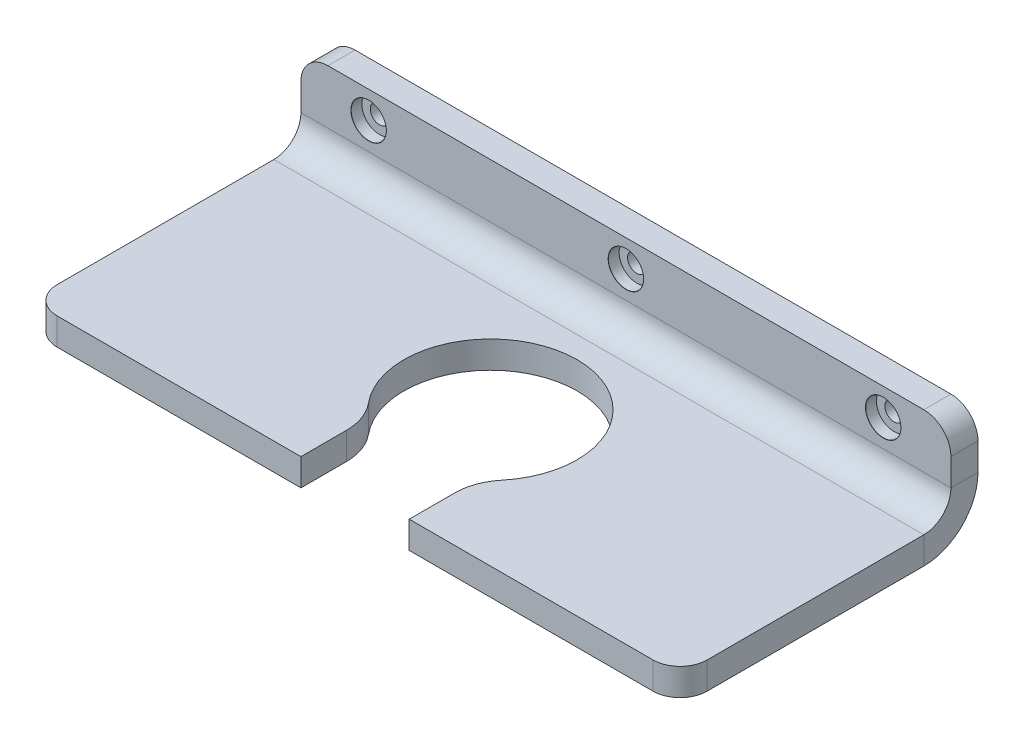
from build123d import *

# Parameters (mm, degrees)
SKETCH1_W                                  = 120
SKETCH1_H                                  = 50
BASE_FLANGE1_DEPTH                         = 5
EDGE_FLANGE1_STRIP_W                       = 30
EDGE_FLANGE1_STRIP_H                       = 5
EDGE_FLANGE1_STRIP_CUT_DEPTH               = 120
EDGE_FLANGE1_DEPTH                         = 120
CUT_EXTRUDE1_DEPTH                         = 10
CBORE_FOR_M3_CHEESE_HEAD_SCREW1_AT_2_COUNT = 2
CBORE_FOR_M3_CHEESE_HEAD_SCREW1_AT_2_PITCH = 47.5
CBORE_FOR_M3_CHEESE_HEAD_SCREW1_AT_3_COUNT = 2
CBORE_FOR_M3_CHEESE_HEAD_SCREW1_AT_3_PITCH = 95
BREAK_CORNER1_START                        = -30
BREAK_CORNER1_DEPTH                        = 5
BREAK_CORNER1_2_DEPTH                      = 5


# Read off the part's stored shape, not the designer's step: Break-Corner1
# Sheet-metal steps are written as plain solids
with BuildPart() as part:
    # Sketch1 → Base-Flange1 (new body)
    with BuildSketch(Plane(origin=(0, 0, 0), x_dir=(1, 0, 0), z_dir=(0, 1, 0))):
        Rectangle(SKETCH1_W, SKETCH1_H)
    extrude(amount=BASE_FLANGE1_DEPTH)

    # Edge-Flange1 strip (across the edge) → Edge-Flange1 strip cut (cut)
    with BuildSketch(Plane(origin=(60, 5, -25), x_dir=(0, 0, 1), z_dir=(-1, 0, 0))):
        with Locations((-10, -2.5)):
            Rectangle(EDGE_FLANGE1_STRIP_W, EDGE_FLANGE1_STRIP_H)
    extrude(amount=EDGE_FLANGE1_STRIP_CUT_DEPTH, mode=Mode.SUBTRACT)

    # Edge-Flange1 section (across the edge) → Edge-Flange1 (add)
    with BuildSketch(Plane(origin=(60, 5, -25), x_dir=(0, 0, 1), z_dir=(-1, 0, 0))):
        with BuildLine():
            Line((-5, 5), (-5, 15))
            Line((-5, 15), (0, 15))
            Line((0, 15), (0, 5))
            ThreePointArc((0, 5), (1.464466094, 1.464466094), (5, 0))
            Line((5, 0), (5, -5))
            ThreePointArc((5, -5), (-2.071067812, -2.071067812), (-5, 5))
        make_face()
    extrude(amount=EDGE_FLANGE1_DEPTH)

    # Sketch9 → Cut-Extrude1 (cut)
    with BuildSketch(Plane(origin=(0, 5, 0), x_dir=(1, 0, 0), z_dir=(0, 1, 0))):
        with BuildLine():
            Line((-10, -25), (-10, -16.613247726))
            ThreePointArc((-10, -16.613247726), (-10.594600569, -13.216416623), (-12.307692308, -10.223537062))
            ThreePointArc((-12.307692308, -10.223537062), (0, 16), (12.307692308, -10.223537062))
            ThreePointArc((12.307692308, -10.223537062), (10.594600569, -13.216416623), (10, -16.613247726))
            Line((10, -16.613247726), (10, -25))
            Line((10, -25), (-10, -25))
        make_face()
    extrude(amount=-CUT_EXTRUDE1_DEPTH, mode=Mode.SUBTRACT)

    # Sketch14 → CBORE for M3 Cheese Head Screw1 (revolve, cut)
    with BuildSketch(Plane(origin=(-47.5, 15, -25), x_dir=(0, -1, 0), z_dir=(1, 0, 0))):
        Polygon((0, 0), (0, 5), (1.7, 5), (1.7, 2), (3.25, 2), (3.25, 0.025), (3.275, 0), align=None)
    cbore_for_m3_cheese_head_screw1 = revolve(axis=Axis((-47.5, 15, -18.65), (0, 0, -1)), mode=Mode.SUBTRACT)

    # CBORE for M3 Cheese Head Screw1 at 2: CBORE for M3 Cheese Head Screw1 ×2
    with Locations(*[(i * CBORE_FOR_M3_CHEESE_HEAD_SCREW1_AT_2_PITCH, 0, 0) for i in range(1, CBORE_FOR_M3_CHEESE_HEAD_SCREW1_AT_2_COUNT)]):
        add(cbore_for_m3_cheese_head_screw1, mode=Mode.SUBTRACT)

    # CBORE for M3 Cheese Head Screw1 at 3: CBORE for M3 Cheese Head Screw1 ×2
    with Locations(*[(i * CBORE_FOR_M3_CHEESE_HEAD_SCREW1_AT_3_PITCH, 0, 0) for i in range(1, CBORE_FOR_M3_CHEESE_HEAD_SCREW1_AT_3_COUNT)]):
        add(cbore_for_m3_cheese_head_screw1, mode=Mode.SUBTRACT)

    # Break-Corner1 outline → Break-Corner1 (cut)
    with BuildSketch(Plane.XY.offset(BREAK_CORNER1_START)):
        with BuildLine():
            Line((60, 20), (55, 20))
            ThreePointArc((55, 20), (58.535533906, 18.535533906), (60, 15))
            Line((60, 15), (60, 20))
        make_face()
        with BuildLine():
            ThreePointArc((-60, 15), (-58.535533906, 18.535533906), (-55, 20))
            Line((-55, 20), (-60, 20))
            Line((-60, 20), (-60, 15))
        make_face()
    extrude(amount=BREAK_CORNER1_DEPTH, mode=Mode.SUBTRACT)

    # Break-Corner1 2 outline → Break-Corner1 2 (cut)
    with BuildSketch(Plane(origin=(0, 0, 0), x_dir=(1, 0, 0), z_dir=(0, 1, 0))):
        with BuildLine():
            Line((60, -25), (60, -20))
            ThreePointArc((60, -20), (58.535533906, -23.535533906), (55, -25))
            Line((55, -25), (60, -25))
        make_face()
        with BuildLine():
            Line((-60, -25), (-55, -25))
            ThreePointArc((-55, -25), (-58.535533906, -23.535533906), (-60, -20))
            Line((-60, -20), (-60, -25))
        make_face()
    extrude(amount=BREAK_CORNER1_2_DEPTH, mode=Mode.SUBTRACT)


solid = part.part
